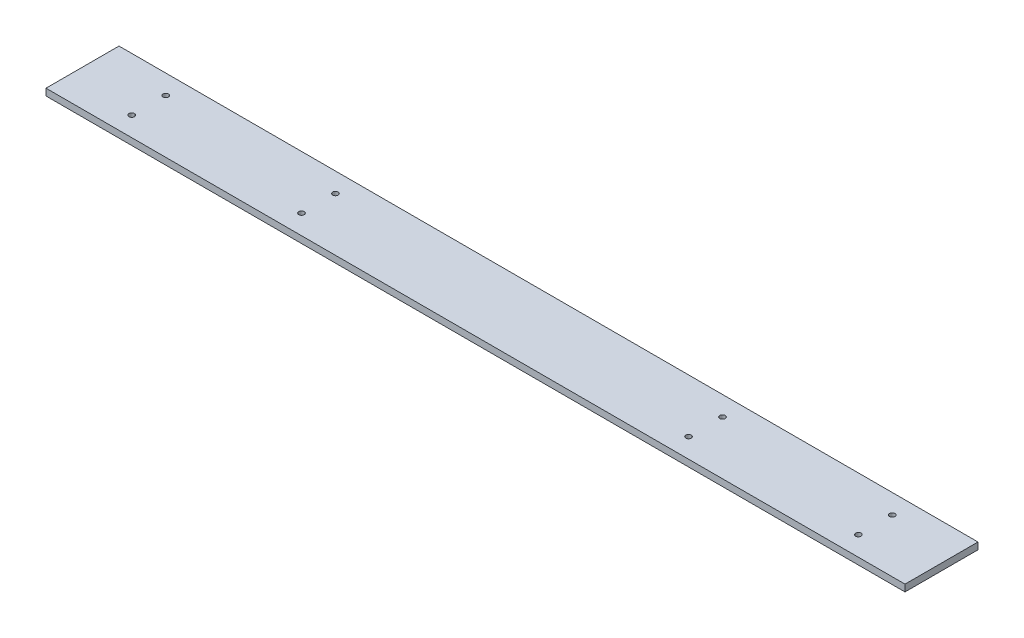
from build123d import *

# Parameters (mm, degrees)
SKETCH1_W           = 506
SKETCH1_H           = 43
BOSS_EXTRUDE1_DEPTH = 4
SKETCH3_R           = 1.6
CUT_EXTRUDE1_DEPTH  = 254.943399205


with BuildPart() as part:
    # Sketch1 → Boss-Extrude1 (new body)
    with BuildSketch(Plane(origin=(0, 0, 0), x_dir=(1, 0, 0), z_dir=(0, 1, 0))):
        Rectangle(SKETCH1_W, SKETCH1_H)
    extrude(amount=BOSS_EXTRUDE1_DEPTH)

    # Sketch3 → Cut-Extrude1 (cut, through all)
    with BuildSketch(Plane.XZ):
        with Locations((114, 10)):
            Circle(SKETCH3_R)
        with Locations((214, 10)):
            Circle(SKETCH3_R)
        with Locations((214, -10)):
            Circle(SKETCH3_R)
        with Locations((114, -10)):
            Circle(SKETCH3_R)
    cut_extrude1 = extrude(amount=-CUT_EXTRUDE1_DEPTH, mode=Mode.SUBTRACT)

    # Mirror1: Cut-Extrude1 across plane
    add(cut_extrude1.mirror(Plane(origin=(0, 0, 0), x_dir=(0, 0, 1), z_dir=(1, 0, 0))), mode=Mode.SUBTRACT)


solid = part.part
